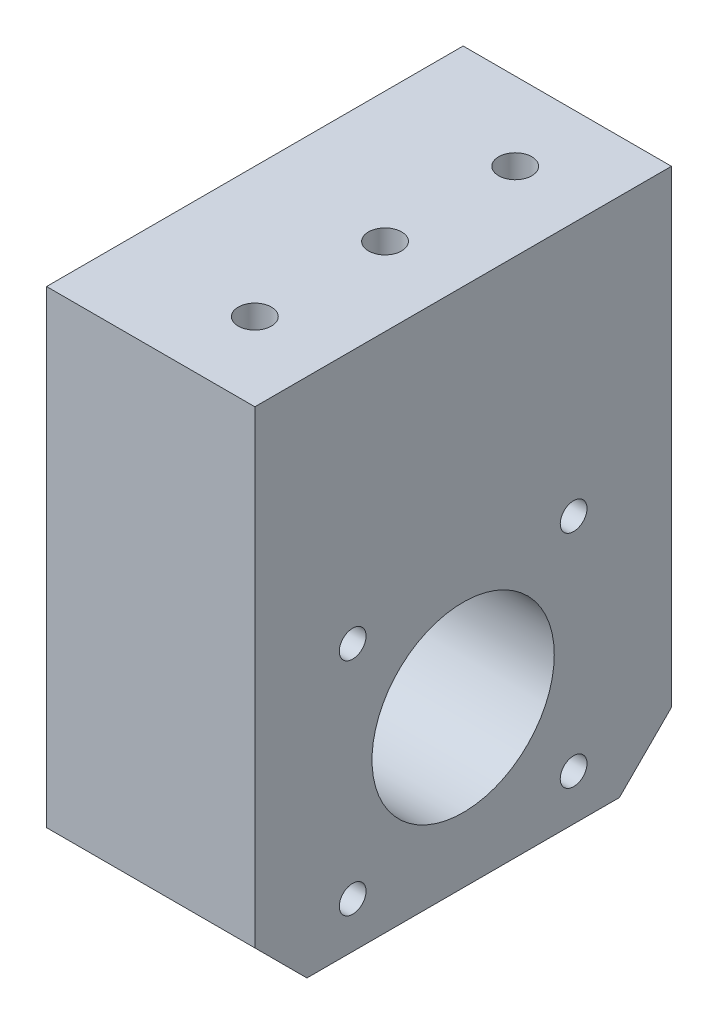
from build123d import *

# Parameters (mm, degrees)
SKETCH1_W                                      = 50.8
SKETCH1_H                                      = 63.5
BASE_DEPTH                                     = 25.4
F_7_8_0_875_DIAMETER_HOLE1_D                   = 22.225
F_10_32_TAPPED_HOLE1_D                         = 4.0386
F_10_32_TAPPED_HOLE1_DEPTH                     = 25.4
F_10_32_TAPPED_HOLE1_TIP                       = 1.213317848
CBORE_FOR_4_SOCKET_HEAD_CAP_SCREW1_D           = 3.2639
CBORE_FOR_4_SOCKET_HEAD_CAP_SCREW1_CBORE_D     = 5.55752
CBORE_FOR_4_SOCKET_HEAD_CAP_SCREW1_CBORE_DEPTH = 2.8448
CIRPATTERN1_COUNT                              = 4
CHAMFER2_SIZE                                  = 6.35


with BuildPart() as part:
    # Sketch1 → Base (new body)
    with BuildSketch(Plane(origin=(0, 0, 0), x_dir=(0, 0, -1), z_dir=(1, 0, 0))):
        Rectangle(SKETCH1_W, SKETCH1_H)
    extrude(amount=BASE_DEPTH)

    # 7/8 (0.875) Diameter Hole1 (through all)
    with Locations(Plane(origin=(25.4, 0, 0), x_dir=(0, 0, -1), z_dir=(1, 0, 0))):
        with Locations((0, -12.7)):
            Hole(F_7_8_0_875_DIAMETER_HOLE1_D / 2)

    # #10-32 Tapped Hole1
    with Locations(Plane(origin=(0, 31.75, 0), x_dir=(1, 0, 0), z_dir=(0, 1, 0))):
        with Locations((15.875, 15.875), (15.875, -15.875), (15.875, 0)):
            Hole(F_10_32_TAPPED_HOLE1_D / 2, depth=F_10_32_TAPPED_HOLE1_DEPTH)
            with Locations((0, 0, -(F_10_32_TAPPED_HOLE1_DEPTH + F_10_32_TAPPED_HOLE1_TIP / 2))):  # 118° drill point
                Cone(0, F_10_32_TAPPED_HOLE1_D / 2, F_10_32_TAPPED_HOLE1_TIP, mode=Mode.SUBTRACT)

    # CBORE for #4 Socket Head Cap Screw1 (through all)
    with Locations(Plane.ZY):
        with Locations((-13.470384182, 0.770384182)):
            cbore_for_4_socket_head_cap_screw1 = CounterBoreHole(CBORE_FOR_4_SOCKET_HEAD_CAP_SCREW1_D / 2, CBORE_FOR_4_SOCKET_HEAD_CAP_SCREW1_CBORE_D / 2, CBORE_FOR_4_SOCKET_HEAD_CAP_SCREW1_CBORE_DEPTH)

    # CirPattern1: CBORE for #4 Socket Head Cap Screw1 ×4 about axis
    cirpattern1_axis = Axis((0, -12.7, 0), (1, 0, 0))
    for i in range(1, CIRPATTERN1_COUNT):
        add(cbore_for_4_socket_head_cap_screw1.rotate(cirpattern1_axis, i * 360 / CIRPATTERN1_COUNT), mode=Mode.SUBTRACT)

    # Chamfer2
    chamfer2_edges = [part.edges().sort_by_distance(p)[0] for p in [
        (12.7, -31.75, 25.4),
        (12.7, -31.75, -25.4),
    ]]
    chamfer(chamfer2_edges, length=CHAMFER2_SIZE)


solid = part.part
